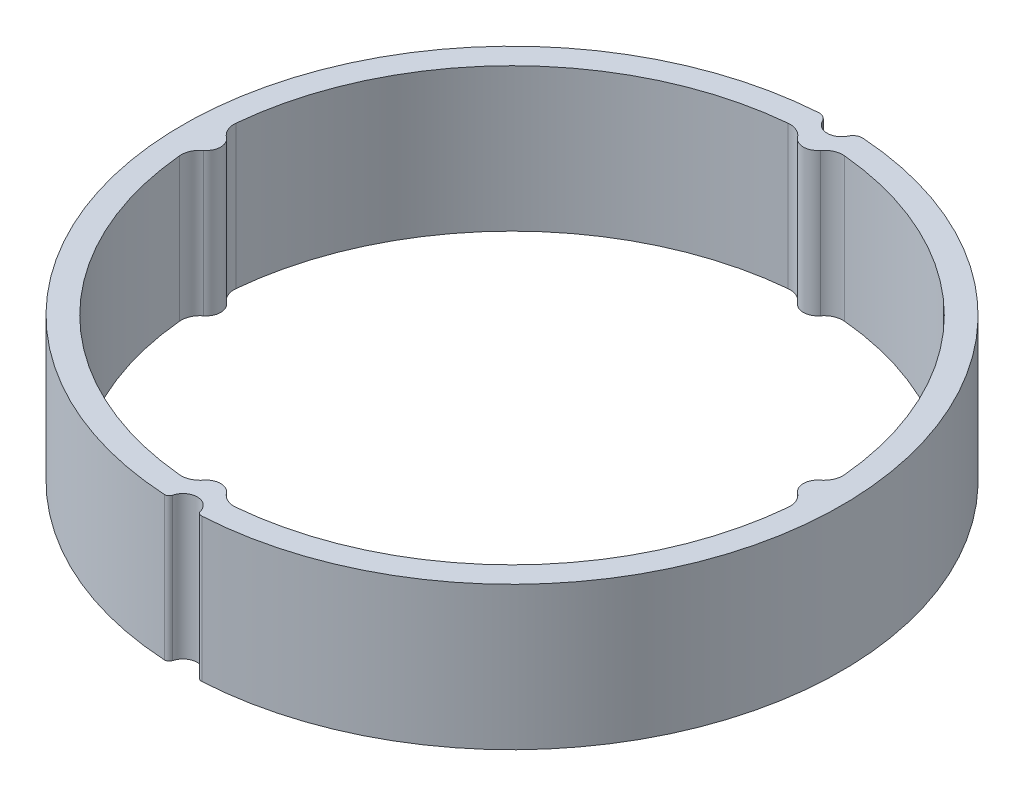
from build123d import *

# Parameters (mm, degrees)
BOSS_EXTRUDE1_DEPTH = 15
CUT_EXTRUDE2_DEPTH  = 52.005488517


with BuildPart() as part:
    # Sketch1 → Boss-Extrude1 (new body)
    with BuildSketch(Plane(origin=(0, 0, 0), x_dir=(1, 0, 0), z_dir=(0, 1, 0))):
        with BuildLine():
            ThreePointArc((1.451818925, -34.068556857), (1.641248992, -34.346908706), (1.964225605, -34.442038138))
            ThreePointArc((1.964225605, -34.442038138), (26.591847487, -21.978073076), (34.198225299, 4.555174015))
            ThreePointArc((34.198225299, 4.555174015), (23.590291339, 25.176355888), (2.324135821, 34.423627607))
            ThreePointArc((2.324135821, 34.423627607), (1.751838249, 34.289058819), (1.354061739, 33.856153382))
            ThreePointArc((1.354061739, 33.856153382), (0, 33.001534515), (-1.354061739, 33.856153382))
            ThreePointArc((-1.354061739, 33.856153382), (-1.751838249, 34.289058819), (-2.324135821, 34.423627607))
            ThreePointArc((-2.324135821, 34.423627607), (-23.590291339, 25.176355888), (-34.198225299, 4.555174015))
            ThreePointArc((-34.198225299, 4.555174015), (-26.591847487, -21.978073076), (-1.964225605, -34.442038138))
            ThreePointArc((-1.964225605, -34.442038138), (-1.641248992, -34.346908706), (-1.451818925, -34.068556857))
            ThreePointArc((-1.451818925, -34.068556857), (0, -32.945679925), (1.451818925, -34.068556857))
        make_face()
        with BuildLine():
            Line((-2.417, 3.787737139), (0, 3.787737139))
            Line((0, 3.787737139), (2.417, 3.787737139))
            ThreePointArc((2.417, 3.787737139), (0, -4.489512172), (-2.417, 3.787737139))
        make_face(mode=Mode.SUBTRACT)
    extrude(amount=BOSS_EXTRUDE1_DEPTH)

    # Sketch2 → Cut-Extrude2 (cut, through all)
    with BuildSketch(Plane(origin=(0, 0, 0), x_dir=(1, 0, 0), z_dir=(0, 1, 0))):
        with BuildLine():
            ThreePointArc((-31.8625, -2.963291034), (-22.627416998, -22.627416998), (-2.963291034, -31.8625))
            ThreePointArc((-2.963291034, -31.8625), (-1.977020771, -31.703659042), (-1.190608005, -31.087611607))
            ThreePointArc((-1.190608005, -31.087611607), (0, -30.5), (1.190608005, -31.087611607))
            ThreePointArc((1.190608005, -31.087611607), (1.977020771, -31.703659042), (2.963291034, -31.8625))
            ThreePointArc((2.963291034, -31.8625), (22.627416998, -22.627416998), (31.8625, -2.963291034))
            ThreePointArc((31.8625, -2.963291034), (31.703659042, -1.977020771), (31.087611607, -1.190608005))
            ThreePointArc((31.087611607, -1.190608005), (30.5, 0), (31.087611607, 1.190608005))
            ThreePointArc((31.087611607, 1.190608005), (31.703659042, 1.977020771), (31.8625, 2.963291034))
            ThreePointArc((31.8625, 2.963291034), (22.627416998, 22.627416998), (2.963291034, 31.8625))
            ThreePointArc((2.963291034, 31.8625), (1.977020771, 31.703659042), (1.190608005, 31.087611607))
            ThreePointArc((1.190608005, 31.087611607), (0, 30.5), (-1.190608005, 31.087611607))
            ThreePointArc((-1.190608005, 31.087611607), (-1.977020771, 31.703659042), (-2.963291034, 31.8625))
            ThreePointArc((-2.963291034, 31.8625), (-22.627416998, 22.627416998), (-31.8625, 2.963291034))
            ThreePointArc((-31.8625, 2.963291034), (-31.703659042, 1.977020771), (-31.087611607, 1.190608005))
            ThreePointArc((-31.087611607, 1.190608005), (-30.5, 0), (-31.087611607, -1.190608005))
            ThreePointArc((-31.087611607, -1.190608005), (-31.703659042, -1.977020771), (-31.8625, -2.963291034))
        make_face()
    extrude(amount=CUT_EXTRUDE2_DEPTH, mode=Mode.SUBTRACT)


solid = part.part
